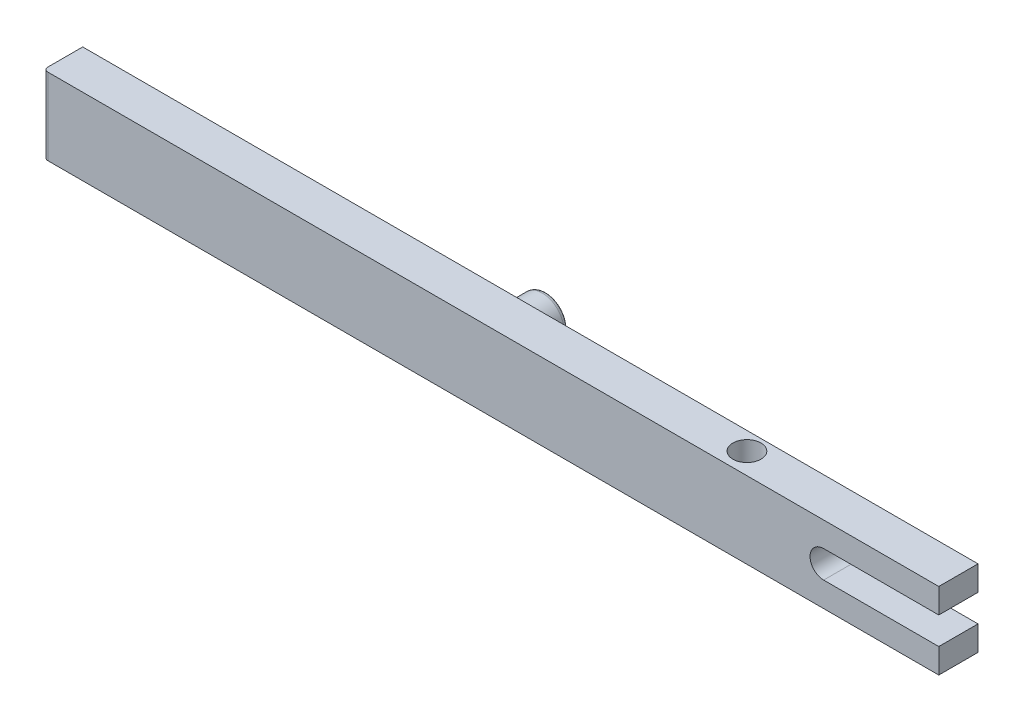
from build123d import *

# Parameters (mm, degrees)
SKETCH1_W           = 105
SKETCH1_H           = 9
BOSS_EXTRUDE1_DEPTH = 5
CUT_EXTRUDE1_DEPTH  = 5
SKETCH8_W           = 8
SKETCH8_H           = 3.2
CUT_EXTRUDE4_DEPTH  = 10
CHAMFER2_SIZE       = 0.4
SKETCH2_R           = 1.65
CUT_EXTRUDE3_DEPTH  = 10
SKETCH10_R          = 2.55
BOSS_EXTRUDE2_DEPTH = 4
FILLET1_R           = 0.5


with BuildPart() as part:
    # Sketch1 → Boss-Extrude1 (new body)
    with BuildSketch(Plane.XY):
        Rectangle(SKETCH1_W, SKETCH1_H)
    extrude(amount=BOSS_EXTRUDE1_DEPTH)

    # Sketch4 → Cut-Extrude1 (cut)
    with BuildSketch(Plane.XY.offset(5)):
        with BuildLine():
            Line((39, 1.6), (45, 1.6))
            ThreePointArc((45, 1.6), (46.6, 0), (45, -1.6))
            Line((45, -1.6), (39, -1.6))
            ThreePointArc((39, -1.6), (37.4, 0), (39, 1.6))
        make_face()
    extrude(amount=-CUT_EXTRUDE1_DEPTH, mode=Mode.SUBTRACT)

    # Sketch8 → Cut-Extrude4 (cut)
    with BuildSketch(Plane.XY.offset(5)):
        with Locations((48.5, 0)):
            Rectangle(SKETCH8_W, SKETCH8_H)
    extrude(amount=-CUT_EXTRUDE4_DEPTH, mode=Mode.SUBTRACT)

    # Chamfer2
    chamfer2_edges = [part.edges().sort_by_distance(p)[0] for p in [
        (52.5, 3.05, 0),
        (52.5, -3.05, 0),
        (0, 4.5, 0),
        (-52.5, 0, 0),
        (0, -4.5, 0),
        (45.75, -1.6, 0),
        (37.4, 0, 0),
        (45.75, 1.6, 0),
    ]]
    chamfer(chamfer2_edges, length=CHAMFER2_SIZE)

    # Sketch2 → Cut-Extrude3 (cut)
    with BuildSketch(Plane(origin=(0, 4.5, 0), x_dir=(1, 0, 0), z_dir=(0, 1, 0))):
        with Locations((27.5, -2.5)):
            Circle(SKETCH2_R)
    extrude(amount=-CUT_EXTRUDE3_DEPTH, mode=Mode.SUBTRACT)

    # Sketch10 → Boss-Extrude2 (add)
    with BuildSketch(Plane.XY):
        with Locations((-2.5, 0)):
            Circle(SKETCH10_R)
    extrude(amount=-BOSS_EXTRUDE2_DEPTH)

    # Fillet1
    fillet1_edges = [part.edges().sort_by_distance(p)[0] for p in [
        (-5.05, 0, -4),
        (-52.5, 0, 5),
    ]]
    fillet(fillet1_edges, radius=FILLET1_R)


solid = part.part
